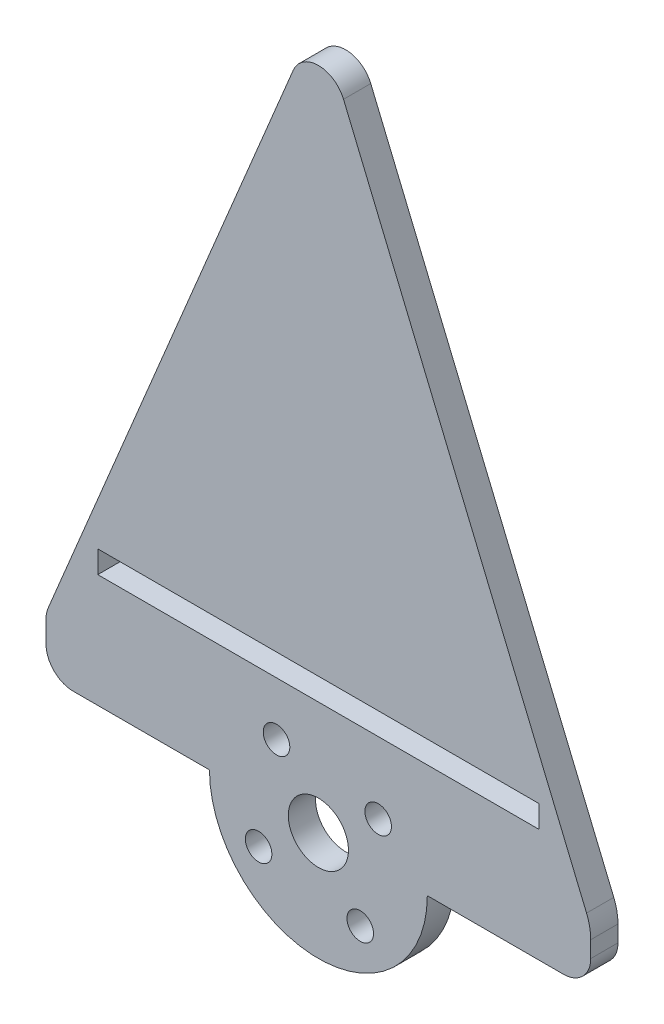
from build123d import *

# Parameters (mm, degrees)
BOSS_EXTRUDE1_DEPTH = 3.175
FILLET4_R           = 3.175
FILLET5_R           = 3.175
FILLET6_R           = 3.175
FILLET7_R           = 6.35
FILLET8_R           = 3.175
SKETCH2_R           = 3.5052
SKETCH2_R_2         = 1.5494
CUT_EXTRUDE1_DEPTH  = 78.949968089
SKETCH4_W           = 51.435
SKETCH4_H           = 2.6035
CUT_EXTRUDE2_DEPTH  = 78.949968089


with BuildPart() as part:
    # Sketch1 → Boss-Extrude1 (new body)
    with BuildSketch(Plane.XY):
        with BuildLine():
            Line((-31.75, 0), (-31.75, -6.35))
            Line((-31.75, -6.35), (-12.7, -6.35))
            ThreePointArc((-12.7, -6.35), (0, -19.05), (12.7, -6.35))
            Line((12.7, -6.35), (31.75, -6.35))
            Line((31.75, -6.35), (31.75, 0))
            Line((31.75, 0), (0, 76.2))
            Line((0, 76.2), (-31.75, 0))
        make_face()
    extrude(amount=BOSS_EXTRUDE1_DEPTH)

    # Fillet4
    fillet4_edges = [part.edges().sort_by_distance(p)[0] for p in [
        (-31.75, -6.35, 1.5875),
    ]]
    fillet(fillet4_edges, radius=FILLET4_R)

    # Fillet5
    fillet5_edges = [part.edges().sort_by_distance(p)[0] for p in [
        (-31.75, 0, 1.5875),
    ]]
    fillet(fillet5_edges, radius=FILLET5_R)

    # Fillet6
    fillet6_edges = [part.edges().sort_by_distance(p)[0] for p in [
        (0, 76.2, 1.5875),
    ]]
    fillet(fillet6_edges, radius=FILLET6_R)

    # Fillet7
    fillet7_edges = [part.edges().sort_by_distance(p)[0] for p in [
        (31.75, 0, 1.5875),
    ]]
    fillet(fillet7_edges, radius=FILLET7_R)

    # Fillet8
    fillet8_edges = [part.edges().sort_by_distance(p)[0] for p in [
        (31.75, -6.35, 1.5875),
    ]]
    fillet(fillet8_edges, radius=FILLET8_R)

    # Sketch2 → Cut-Extrude1 (cut, through all)
    with BuildSketch(Plane.XY.offset(3.175)):
        with Locations((0, -6.35)):
            Circle(SKETCH2_R)
        with Locations((-4.880561897, 0.620164745)):
            Circle(SKETCH2_R_2)
        with Locations((4.880561897, -13.320164745)):
            Circle(SKETCH2_R_2)
        with Locations((6.970164745, -1.469438103)):
            Circle(SKETCH2_R_2)
        with Locations((-6.970164745, -11.230561897)):
            Circle(SKETCH2_R_2)
    extrude(amount=-CUT_EXTRUDE1_DEPTH, mode=Mode.SUBTRACT)

    # Sketch4 → Cut-Extrude2 (cut, through all)
    with BuildSketch(Plane.XY.offset(3.175)):
        with Locations((0, 8.154999946)):
            Rectangle(SKETCH4_W, SKETCH4_H)
    extrude(amount=-CUT_EXTRUDE2_DEPTH, mode=Mode.SUBTRACT)


solid = part.part
